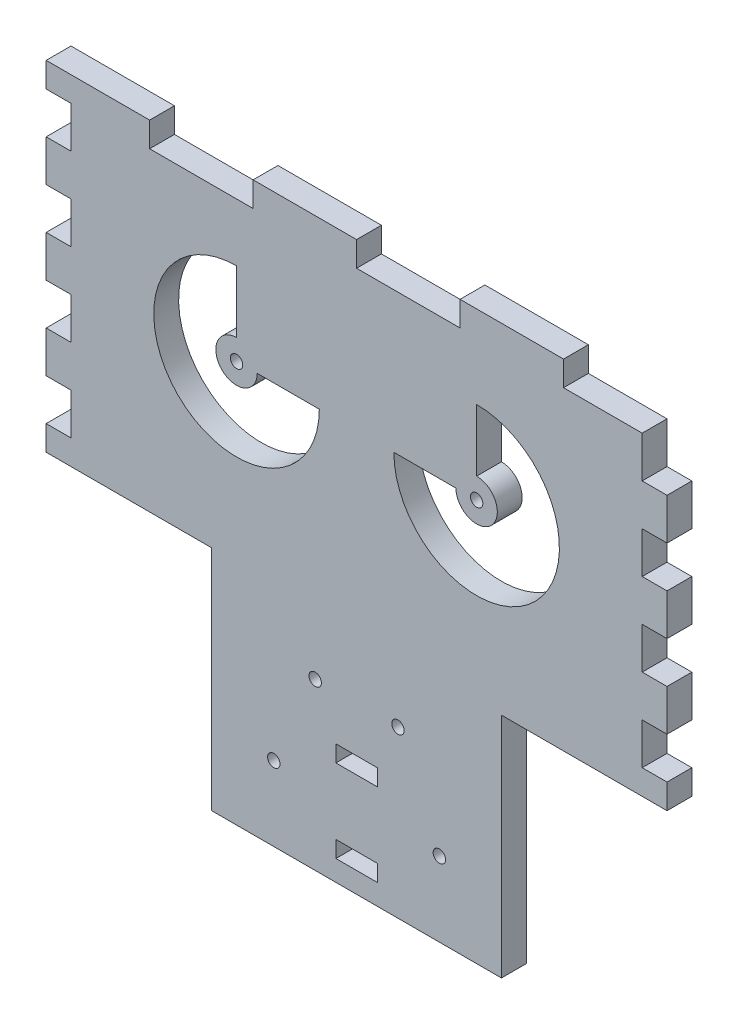
from build123d import *

# Parameters (mm, degrees)
BOSS_EXTRUDE1_DEPTH = 6
SKETCH2_W           = 6
SKETCH2_H           = 10
CUT_EXTRUDE1_DEPTH  = 10
SKETCH3_R           = 1.5
CUT_EXTRUDE2_DEPTH  = 6
SKETCH4_W           = 25
SKETCH4_H           = 6
CUT_EXTRUDE3_DEPTH  = 6
SKETCH5_R           = 1.5
SKETCH5_W           = 10
SKETCH5_H           = 4
CUT_EXTRUDE4_DEPTH  = 10


with BuildPart() as part:
    # Sketch1 → Boss-Extrude1 (new body)
    with BuildSketch(Plane.XY):
        Polygon((35, -41), (75, -41), (75, 41), (-75, 41), (-75, -41), (-35, -41), (-35, -96), (35, -96), align=None)
    extrude(amount=BOSS_EXTRUDE1_DEPTH)

    # Sketch2 → Cut-Extrude1 (cut)
    with BuildSketch(Plane.XY.offset(6)):
        with Locations((-72, 30)):
            Rectangle(SKETCH2_W, SKETCH2_H)
        with Locations((72, 30)):
            Rectangle(SKETCH2_W, SKETCH2_H)
        with Locations((72, 10)):
            Rectangle(SKETCH2_W, SKETCH2_H)
        with Locations((-72, 10)):
            Rectangle(SKETCH2_W, SKETCH2_H)
        with Locations((-72, -10)):
            Rectangle(SKETCH2_W, SKETCH2_H)
        with Locations((72, -10)):
            Rectangle(SKETCH2_W, SKETCH2_H)
        with Locations((-72, -30)):
            Rectangle(SKETCH2_W, SKETCH2_H)
        with Locations((72, -30)):
            Rectangle(SKETCH2_W, SKETCH2_H)
    extrude(amount=-CUT_EXTRUDE1_DEPTH, mode=Mode.SUBTRACT)

    # Sketch3 → Cut-Extrude2 (cut)
    with BuildSketch(Plane.XY.offset(6)):
        with Locations((-29, 1)):
            Circle(SKETCH3_R)
        with Locations((29, 1)):
            Circle(SKETCH3_R)
        with BuildLine():
            Line((-9, 1), (-24, 1))
            ThreePointArc((-24, 1), (-32.535533906, -2.535533906), (-29, 6))
            Line((-29, 6), (-29, 21))
            ThreePointArc((-29, 21), (-43.142135624, -13.142135624), (-9, 1))
        make_face()
        with BuildLine():
            Line((9, 1), (24, 1))
            ThreePointArc((24, 1), (32.535533906, -2.535533906), (29, 6))
            Line((29, 6), (29, 21))
            ThreePointArc((29, 21), (43.142135624, -13.142135624), (9, 1))
        make_face()
    extrude(amount=-CUT_EXTRUDE2_DEPTH, mode=Mode.SUBTRACT)

    # Sketch4 → Cut-Extrude3 (cut)
    with BuildSketch(Plane.XY.offset(6)):
        with Locations((12.5, 38)):
            Rectangle(SKETCH4_W, SKETCH4_H)
        with Locations((62.5, 38)):
            Rectangle(SKETCH4_W, SKETCH4_H)
        with Locations((-37.5, 38)):
            Rectangle(SKETCH4_W, SKETCH4_H)
    extrude(amount=-CUT_EXTRUDE3_DEPTH, mode=Mode.SUBTRACT)

    # Sketch5 → Cut-Extrude4 (cut)
    with BuildSketch(Plane.XY.offset(6)):
        with Locations((-10, -56)):
            Circle(SKETCH5_R)
        with Locations((10, -56)):
            Circle(SKETCH5_R)
        with Locations((-20, -78)):
            Circle(SKETCH5_R)
        with Locations((20, -78)):
            Circle(SKETCH5_R)
        with Locations((0, -69)):
            Rectangle(SKETCH5_W, SKETCH5_H)
        with Locations((0, -89)):
            Rectangle(SKETCH5_W, SKETCH5_H)
    extrude(amount=-CUT_EXTRUDE4_DEPTH, mode=Mode.SUBTRACT)


solid = part.part
